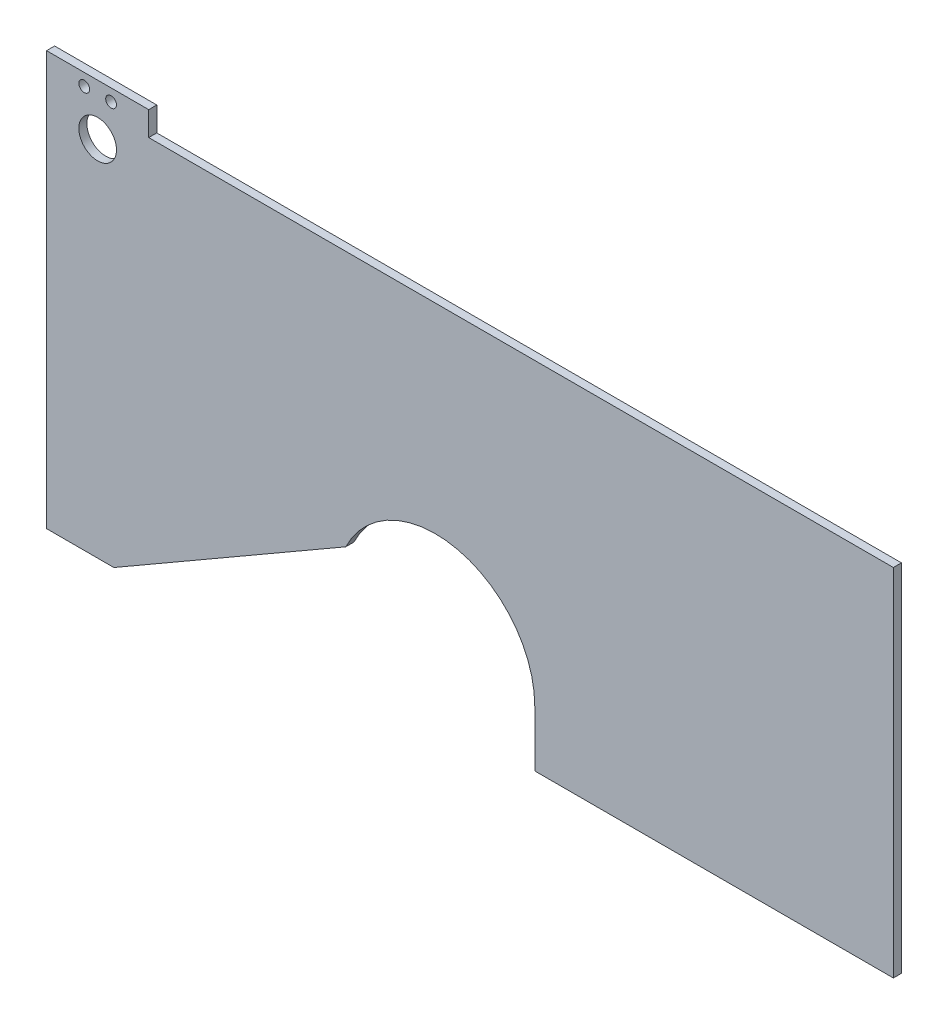
from build123d import *

# Parameters (mm, degrees)
SKETCH2_R           = 7
SKETCH2_R_2         = 2
BOSS_EXTRUDE2_DEPTH = 3
SKETCH3_W           = 133.4
SKETCH3_H           = 12.75
CUT_EXTRUDE1_DEPTH  = 351.642267846


with BuildPart() as part:
    # Sketch2 → Boss-Extrude2 (new body)
    with BuildSketch(Plane.XY):
        with BuildLine():
            Line((25.03035901, 0), (111.286489227, 49.8))
            ThreePointArc((111.286489227, 49.8), (152.858332199, 69.766604349), (181.6, 33.7))
            Line((181.6, 33.7), (181.6, 0))
            Line((181.6, 0), (315, 0))
            Line((315, 0), (315, 145))
            Line((315, 145), (38, 145))
            Line((38, 145), (38, 154))
            Line((38, 154), (19, 154))
            Line((19, 154), (0, 154))
            Line((0, 154), (0, 0))
            Line((0, 0), (25.03035901, 0))
        make_face()
        with Locations((19, 135)):
            Circle(SKETCH2_R, mode=Mode.SUBTRACT)
        with Locations((14, 149.5)):
            Circle(SKETCH2_R_2, mode=Mode.SUBTRACT)
        with Locations((24, 149.5)):
            Circle(SKETCH2_R_2, mode=Mode.SUBTRACT)
    extrude(amount=BOSS_EXTRUDE2_DEPTH)

    # Sketch3 → Cut-Extrude1 (cut, through all)
    with BuildSketch(Plane.XY.offset(3)):
        with Locations((248.3, 6.375)):
            Rectangle(SKETCH3_W, SKETCH3_H)
    extrude(amount=-CUT_EXTRUDE1_DEPTH, mode=Mode.SUBTRACT)


solid = part.part
